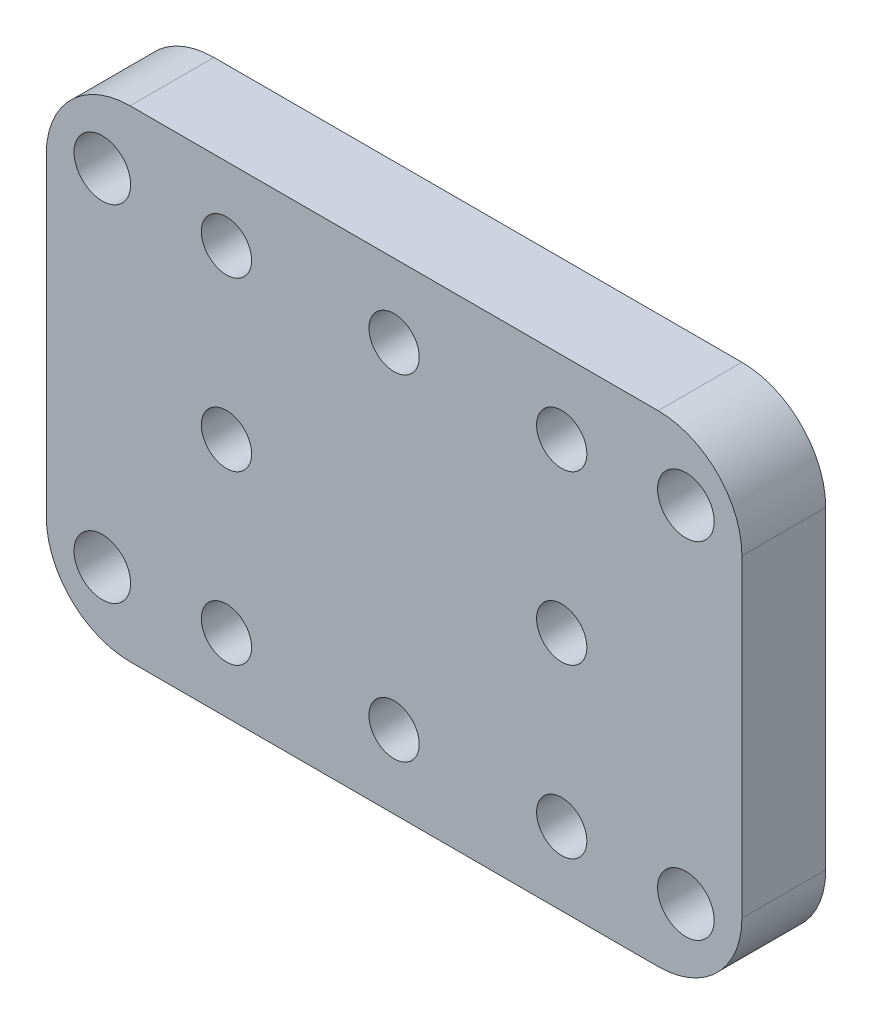
from build123d import *

# Parameters (mm, degrees)
CROQUIS1_W              = 33.201006025
CROQUIS1_H              = 22.978323476
SALIENTE_EXTRUIR1_DEPTH = 4
REDONDEO2_R             = 4
REDONDEO3_R             = 4
CROQUIS4_R              = 1.2
CORTAR_EXTRUIR3_DEPTH   = 41.665750555
CROQUIS3D2_R            = 1.35
CORTAR_EXTRUIR4_DEPTH   = 23
CROQUIS5_R              = 2
CORTAR_EXTRUIR5_DEPTH   = 2


with BuildPart() as part:
    # Croquis1 → Saliente-Extruir1 (new body)
    with BuildSketch(Plane.XY):
        with Locations((16.58985656, 11.664742893)):
            Rectangle(CROQUIS1_W, CROQUIS1_H)
    extrude(amount=SALIENTE_EXTRUIR1_DEPTH)

    # Redondeo2
    redondeo2_edges = [part.edges().sort_by_distance(p)[0] for p in [
        (33.190359572, 0.175581155, 2),
        (33.190359572, 23.153904631, 2),
    ]]
    fillet(redondeo2_edges, radius=REDONDEO2_R)

    # Redondeo3
    redondeo3_edges = [part.edges().sort_by_distance(p)[0] for p in [
        (-0.010646453, 0.175581155, 2),
        (-0.010646453, 23.153904631, 2),
    ]]
    fillet(redondeo3_edges, radius=REDONDEO3_R)

    # Croquis4 → Cortar-Extruir3 (cut, through all)
    with BuildSketch(Plane.XY.offset(4)):
        with Locations((8.589856559, 19.664742893)):
            Circle(CROQUIS4_R)
        with Locations((16.589856559, 19.664742893)):
            Circle(CROQUIS4_R)
        with Locations((8.589856559, 11.664742893)):
            Circle(CROQUIS4_R)
        with Locations((24.589856559, 19.664742893)):
            Circle(CROQUIS4_R)
        with Locations((8.589856559, 3.664742893)):
            Circle(CROQUIS4_R)
        with Locations((24.589856559, 11.664742893)):
            Circle(CROQUIS4_R)
        with Locations((16.589856559, 3.664742893)):
            Circle(CROQUIS4_R)
        with Locations((24.589856559, 3.664742893)):
            Circle(CROQUIS4_R)
    extrude(amount=-CORTAR_EXTRUIR3_DEPTH, mode=Mode.SUBTRACT)

    # Croquis3D2 → Cortar-Extruir4 (cut)
    with BuildSketch(Plane(origin=(2.664856559, 3.424742893, 13), x_dir=(1, 0, 0), z_dir=(0, 0, 1))):
        Circle(CROQUIS3D2_R)
        with Locations((0, 16.48)):
            Circle(CROQUIS3D2_R)
        with Locations((27.85, 0)):
            Circle(CROQUIS3D2_R)
        with Locations((27.85, 16.48)):
            Circle(CROQUIS3D2_R)
    extrude(amount=-CORTAR_EXTRUIR4_DEPTH, mode=Mode.SUBTRACT)

    # Croquis5 → Cortar-Extruir5 (cut)
    with BuildSketch(Plane(origin=(0, 0, 0), x_dir=(-1, 0, 0), z_dir=(0, 0, -1))):
        with Locations((-30.514856559, 19.904742893)):
            Circle(CROQUIS5_R)
        with Locations((-2.664856559, 19.904742893)):
            Circle(CROQUIS5_R)
        with Locations((-30.514856559, 3.424742893)):
            Circle(CROQUIS5_R)
        with Locations((-2.664856559, 3.424742893)):
            Circle(CROQUIS5_R)
    extrude(amount=-CORTAR_EXTRUIR5_DEPTH, mode=Mode.SUBTRACT)


solid = part.part
